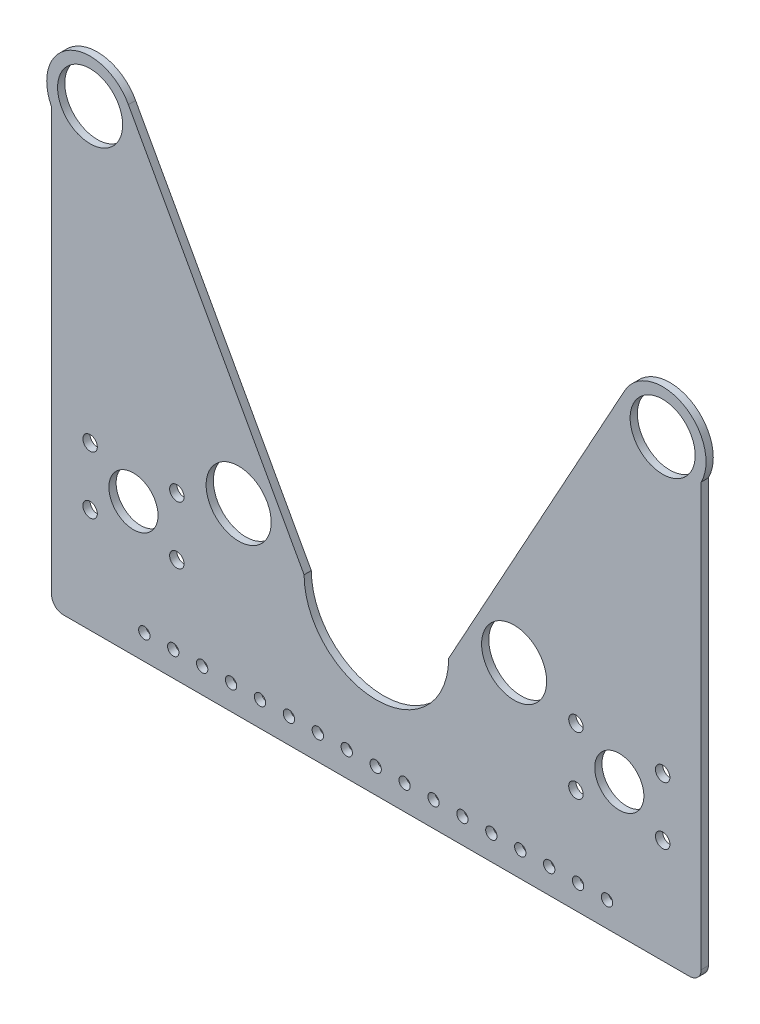
from build123d import *

# Parameters (mm, degrees)
SKETCH2_R           = 2.4892
SKETCH2_R_2         = 3.175
SKETCH2_R_3         = 10.795
SKETCH2_R_4         = 14.2875
BOSS_EXTRUDE1_DEPTH = 3.175


with BuildPart() as part:
    # Sketch2 → Boss-Extrude1 (new body)
    with BuildSketch(Plane.XY):
        with BuildLine():
            Line((142.632381685, -29.937060043), (142.632381685, 122.462939957))
            ThreePointArc((142.632381685, 122.462939957), (134.600001748, 148.101160684), (108.918256202, 140.209048468))
            Line((108.918256202, 140.209048468), (31.75, 0))
            ThreePointArc((31.75, 0), (0, -31.75), (-31.75, 0))
            Line((-31.75, 0), (-108.918256202, 140.209048469))
            ThreePointArc((-108.918256202, 140.209048469), (-134.600001748, 148.101160684), (-142.632381685, 122.462939957))
            Line((-142.632381685, 122.462939957), (-142.632381685, -29.937060043))
            Line((-142.632381685, -29.937060043), (-142.632381685, -57.15))
            Line((-142.632381685, -57.15), (-142.632381685, -63.028571866))
            ThreePointArc((-142.632381685, -63.028571866), (-141.144484133, -66.620674314), (-137.552381685, -68.108571866))
            Line((-137.552381685, -68.108571866), (137.552381685, -68.108571866))
            ThreePointArc((137.552381685, -68.108571866), (141.144484133, -66.620674314), (142.632381685, -63.028571866))
            Line((142.632381685, -63.028571866), (142.632381685, -57.15))
            Line((142.632381685, -57.15), (142.632381685, -29.937060043))
        make_face()
        with Locations((-101.9175, -57.15)):
            Circle(SKETCH2_R, mode=Mode.SUBTRACT)
        with Locations((-89.2175, -57.15)):
            Circle(SKETCH2_R, mode=Mode.SUBTRACT)
        with Locations((-76.5175, -57.15)):
            Circle(SKETCH2_R, mode=Mode.SUBTRACT)
        with Locations((-125.73, -22.225)):
            Circle(SKETCH2_R_2, mode=Mode.SUBTRACT)
        with Locations((-87.63, -22.225)):
            Circle(SKETCH2_R_2, mode=Mode.SUBTRACT)
        with Locations((-63.8175, -57.15)):
            Circle(SKETCH2_R, mode=Mode.SUBTRACT)
        with Locations((-51.1175, -57.15)):
            Circle(SKETCH2_R, mode=Mode.SUBTRACT)
        with Locations((-38.4175, -57.15)):
            Circle(SKETCH2_R, mode=Mode.SUBTRACT)
        with Locations((-25.7175, -57.15)):
            Circle(SKETCH2_R, mode=Mode.SUBTRACT)
        with Locations((-13.0175, -57.15)):
            Circle(SKETCH2_R, mode=Mode.SUBTRACT)
        with Locations((-0.3175, -57.15)):
            Circle(SKETCH2_R, mode=Mode.SUBTRACT)
        with Locations((-125.73, 3.175)):
            Circle(SKETCH2_R_2, mode=Mode.SUBTRACT)
        with Locations((-106.68, -9.525)):
            Circle(SKETCH2_R_3, mode=Mode.SUBTRACT)
        with Locations((-87.63, 3.175)):
            Circle(SKETCH2_R_2, mode=Mode.SUBTRACT)
        with Locations((-60.484532313, 12.7)):
            Circle(SKETCH2_R_4, mode=Mode.SUBTRACT)
        with Locations((12.3825, -57.15)):
            Circle(SKETCH2_R, mode=Mode.SUBTRACT)
        with Locations((25.0825, -57.15)):
            Circle(SKETCH2_R, mode=Mode.SUBTRACT)
        with Locations((37.7825, -57.15)):
            Circle(SKETCH2_R, mode=Mode.SUBTRACT)
        with Locations((50.4825, -57.15)):
            Circle(SKETCH2_R, mode=Mode.SUBTRACT)
        with Locations((63.1825, -57.15)):
            Circle(SKETCH2_R, mode=Mode.SUBTRACT)
        with Locations((75.8825, -57.15)):
            Circle(SKETCH2_R, mode=Mode.SUBTRACT)
        with Locations((88.5825, -57.15)):
            Circle(SKETCH2_R, mode=Mode.SUBTRACT)
        with Locations((101.2825, -57.15)):
            Circle(SKETCH2_R, mode=Mode.SUBTRACT)
        with Locations((87.63, -22.225)):
            Circle(SKETCH2_R_2, mode=Mode.SUBTRACT)
        with Locations((125.73, -22.225)):
            Circle(SKETCH2_R_2, mode=Mode.SUBTRACT)
        with Locations((60.484532313, 12.7)):
            Circle(SKETCH2_R_4, mode=Mode.SUBTRACT)
        with Locations((106.68, -9.525)):
            Circle(SKETCH2_R_3, mode=Mode.SUBTRACT)
        with Locations((87.63, 3.175)):
            Circle(SKETCH2_R_2, mode=Mode.SUBTRACT)
        with Locations((125.73, 3.175)):
            Circle(SKETCH2_R_2, mode=Mode.SUBTRACT)
        with Locations((-125.726814921, 131.243846084)):
            Circle(SKETCH2_R_4, mode=Mode.SUBTRACT)
        with Locations((125.726814921, 131.243846084)):
            Circle(SKETCH2_R_4, mode=Mode.SUBTRACT)
    extrude(amount=BOSS_EXTRUDE1_DEPTH)


solid = part.part
